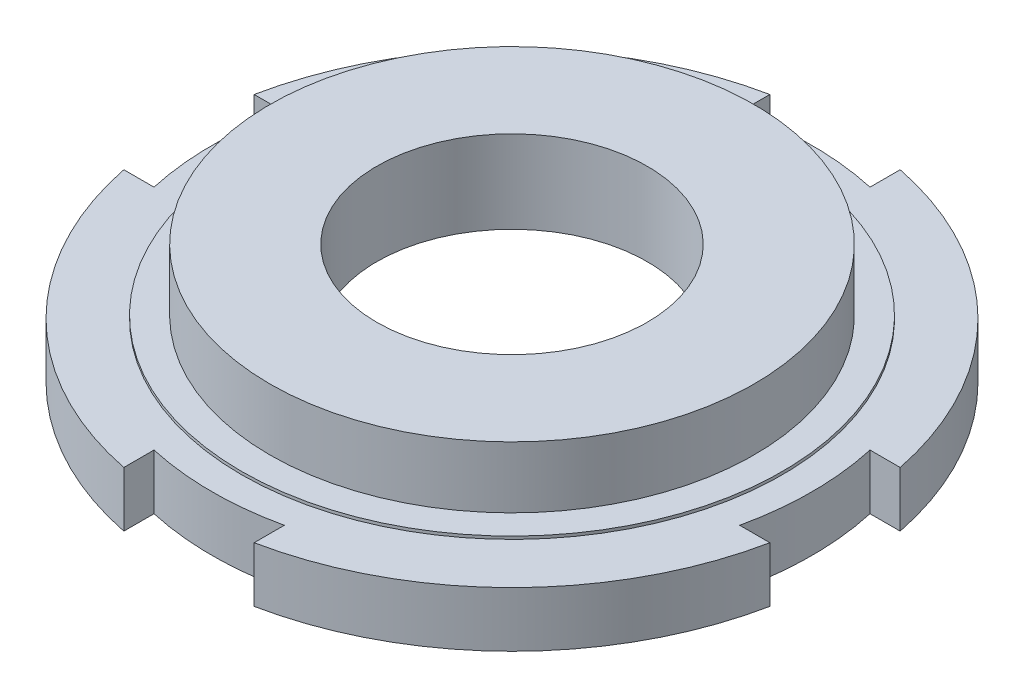
from build123d import *

# Parameters (mm, degrees)
SKETCH1_R           = 13.97
BOSS_EXTRUDE2_DEPTH = 6.0000007
CUT_EXTRUDE1_DEPTH  = 3.81
SKETCH3_R           = 27.94
CUT_EXTRUDE2_DEPTH  = 0.3
SKETCH5_R           = 25.0063
SKETCH5_R_2         = 13.97
BOSS_EXTRUDE3_DEPTH = 6.35
CUT_EXTRUDE3_START  = -0.3
SKETCH6_R           = 50.8
SKETCH6_R_2         = 27.94
CUT_EXTRUDE3_DEPTH  = 0.3


with BuildPart() as part:
    # Sketch1 → Boss-Extrude2 (new body)
    with BuildSketch(Plane(origin=(0, 0, 0), x_dir=(1, 0, 0), z_dir=(0, 1, 0))):
        with BuildLine():
            Line((30.248136852, 6.731), (33.363796771, 6.731))
            ThreePointArc((33.363796771, 6.731), (24.067086404, 24.067086404), (6.731, 33.363796771))
            Line((6.731, 33.363796771), (6.731, 30.248136852))
            ThreePointArc((6.731, 30.248136852), (0, 30.988), (-6.731, 30.248136852))
            Line((-6.731, 30.248136852), (-6.731, 33.363796771))
            ThreePointArc((-6.731, 33.363796771), (-24.067086404, 24.067086404), (-33.363796771, 6.731))
            Line((-33.363796771, 6.731), (-30.248136852, 6.731))
            ThreePointArc((-30.248136852, 6.731), (-30.988, 0), (-30.248136852, -6.731))
            Line((-30.248136852, -6.731), (-33.363796771, -6.731))
            ThreePointArc((-33.363796771, -6.731), (-24.067086404, -24.067086404), (-6.731, -33.363796771))
            Line((-6.731, -33.363796771), (-6.731, -30.248136852))
            ThreePointArc((-6.731, -30.248136852), (0, -30.988), (6.731, -30.248136852))
            Line((6.731, -30.248136852), (6.731, -33.363796771))
            ThreePointArc((6.731, -33.363796771), (24.067086404, -24.067086404), (33.363796771, -6.731))
            Line((33.363796771, -6.731), (30.248136852, -6.731))
            ThreePointArc((30.248136852, -6.731), (30.988, 0), (30.248136852, 6.731))
        make_face()
        Circle(SKETCH1_R, mode=Mode.SUBTRACT)
    extrude(amount=BOSS_EXTRUDE2_DEPTH)

    # Sketch2 → Cut-Extrude1 (cut)
    with BuildSketch(Plane.XZ):
        with BuildLine():
            Line((13.470384182, -13.470384182), (-11.510595831, -38.451364194))
            ThreePointArc((-11.510595831, -38.451364194), (-14.153729266, -37.558929333), (-16.728487375, -36.485050841))
            Line((-16.728487375, -36.485050841), (0.720181493, -19.036381973))
            ThreePointArc((0.720181493, -19.036381973), (-7.621556363, 17.458934063), (13.470384182, -13.470384182))
        make_face()
    extrude(amount=-CUT_EXTRUDE1_DEPTH, mode=Mode.SUBTRACT)

    # Sketch3 → Cut-Extrude2 (cut)
    with BuildSketch(Plane.XZ):
        Circle(SKETCH3_R)
    extrude(amount=-CUT_EXTRUDE2_DEPTH, mode=Mode.SUBTRACT)

    # Sketch5 → Boss-Extrude3 (add)
    with BuildSketch(Plane(origin=(0, 6.0000007, 0), x_dir=(1, 0, 0), z_dir=(0, 1, 0))):
        Circle(SKETCH5_R)
        Circle(SKETCH5_R_2, mode=Mode.SUBTRACT)
    extrude(amount=BOSS_EXTRUDE3_DEPTH)

    # Sketch6 → Cut-Extrude3 (cut)
    with BuildSketch(Plane(origin=(0, 6.0000007, 0), x_dir=(1, 0, 0), z_dir=(0, 1, 0)).offset(CUT_EXTRUDE3_START)):
        Circle(SKETCH6_R)
        Circle(SKETCH6_R_2, mode=Mode.SUBTRACT)
    extrude(amount=CUT_EXTRUDE3_DEPTH, mode=Mode.SUBTRACT)


solid = part.part
